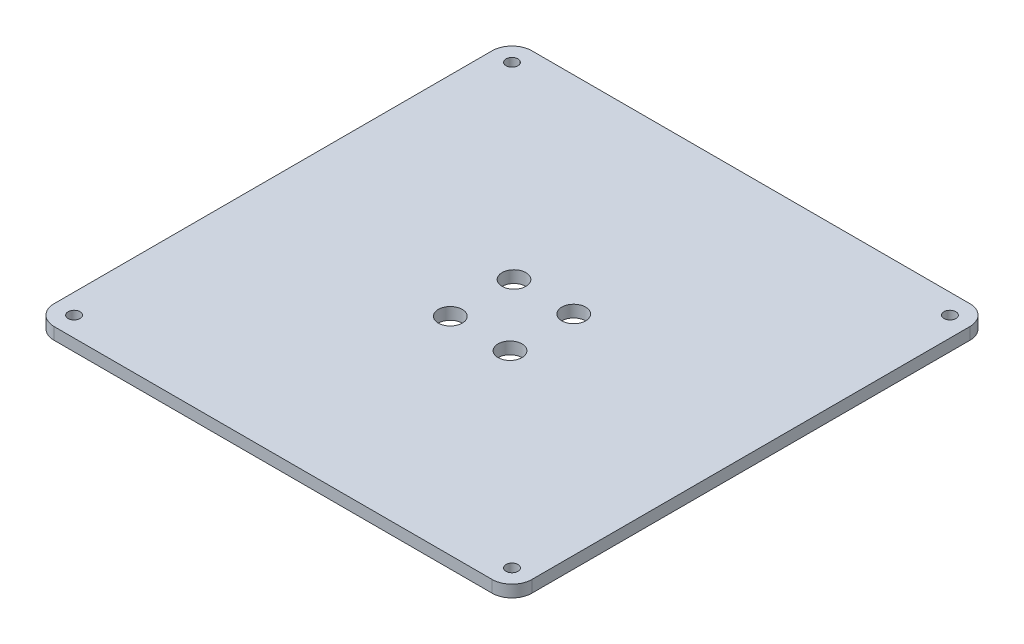
from build123d import *

# Parameters (mm, degrees)
SKETCH1_W                                  = 120
SKETCH1_H                                  = 120
SKETCH1_R                                  = 3
BOSS_EXTRUDE1_DEPTH                        = 3
FILLET1_R                                  = 5
SKETCH2_R                                  = 1.5
CUT_EXTRUDE1_DEPTH                         = 85.905830189
MIRROR3_AT_THE_SECOND_PLANE_COPY_1_SKETC_R = 1.5
MIRROR3_AT_THE_SECOND_PLANE_COPY_1_DEPTH   = 85.905830189


with BuildPart() as part:
    # Sketch1 → Boss-Extrude1 (new body)
    with BuildSketch(Plane(origin=(0, 0, 0), x_dir=(1, 0, 0), z_dir=(0, 1, 0))):
        Rectangle(SKETCH1_W, SKETCH1_H)
        with Locations((-7.5, -8)):
            Circle(SKETCH1_R, mode=Mode.SUBTRACT)
        with Locations((7.5, 8)):
            Circle(SKETCH1_R, mode=Mode.SUBTRACT)
        with Locations((7.5, -8)):
            Circle(SKETCH1_R, mode=Mode.SUBTRACT)
        with Locations((-7.5, 8)):
            Circle(SKETCH1_R, mode=Mode.SUBTRACT)
    extrude(amount=BOSS_EXTRUDE1_DEPTH)

    # Fillet1
    fillet1_edges = [part.edges().sort_by_distance(p)[0] for p in [
        (-60, 1.5, -60),
        (60, 1.5, -60),
        (60, 1.5, 60),
        (-60, 1.5, 60),
    ]]
    fillet(fillet1_edges, radius=FILLET1_R)

    # Sketch2 → Cut-Extrude1 (cut, through all)
    with BuildSketch(Plane(origin=(0, 3, 0), x_dir=(1, 0, 0), z_dir=(0, 1, 0))):
        with Locations((-55, 55)):
            Circle(SKETCH2_R)
    cut_extrude1 = extrude(amount=-CUT_EXTRUDE1_DEPTH, mode=Mode.SUBTRACT)

    # Mirror3: Cut-Extrude1 across plane
    add(cut_extrude1.mirror(Plane.XY), mode=Mode.SUBTRACT)

    # Mirror3 at the second plane: Cut-Extrude1 across plane
    add(cut_extrude1.mirror(Plane(origin=(0, 0, 0), x_dir=(0, 0, 1), z_dir=(1, 0, 0))), mode=Mode.SUBTRACT)

    # Mirror3 at the second plane copy 1 sketc → Mirror3 at the second plane copy 1 (cut, through all)
    with BuildSketch(Plane(origin=(0, 3, 0), x_dir=(-1, 0, 0), z_dir=(0, 1, 0))):
        with Locations((-55, 55)):
            Circle(MIRROR3_AT_THE_SECOND_PLANE_COPY_1_SKETC_R)
    extrude(amount=-MIRROR3_AT_THE_SECOND_PLANE_COPY_1_DEPTH, mode=Mode.SUBTRACT)


solid = part.part
